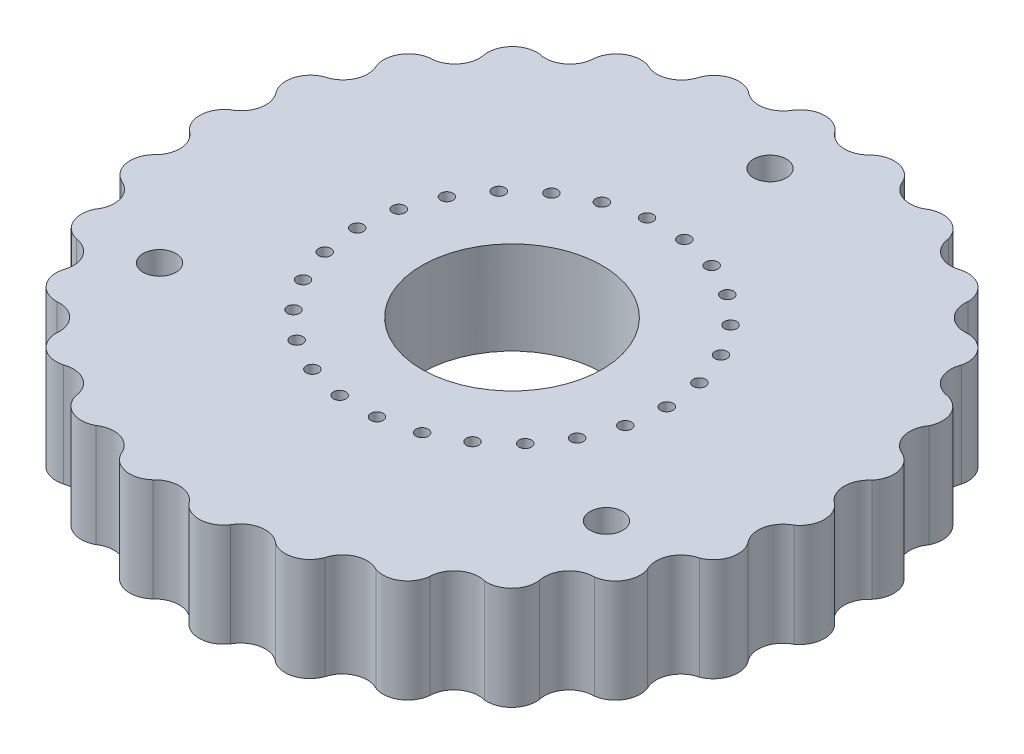
from build123d import *

# Parameters (mm, degrees)
EXTRUDE_WHEEL_DEPTH        = 10
CIRPATTERN1_COUNT          = 26
SKETCH4_R                  = 29
BOSS_EXTRUDE1_DEPTH        = 5
BEARING_HOLE_R             = 8.73125
CUT_BEARING_HOLE_DEPTH     = 48.798947189
PCB_INSET_CUT_DEPTH        = 1
PCB_START                  = -1
PCB_INSET_CUT_2_DEPTH      = 1
PCB_OUTPUT_HOLES_R         = 0.6
PCB_OUTPUT_HOLES_CUT_DEPTH = 48.494624458
SKETCH5_R                  = 1.5875
ALIGNMENT_PIN_CUTOUT_DEPTH = 48.494624458
SKETCH6_R                  = 48.487293603
CUT_EXTRUDE1_DEPTH         = 47.472995948


with BuildPart() as part:
    # Wheel → Extrude wheel (new body)
    with BuildSketch(Plane(origin=(0, 0, 0), x_dir=(1, 0, 0), z_dir=(0, 1, 0))):
        with BuildLine():
            Line((0, 0), (29.128254523, 7.179469929))
            Line((29.128254523, 7.179469929), (30.341931795, 7.478614509))
            ThreePointArc((30.341931795, 7.478614509), (31.616410176, 5.808198613), (31.087663821, 3.774725795))
            ThreePointArc((31.087663821, 3.774725795), (30.249976155, 1.847846509), (31.25, 0))
            Line((31.25, 0), (30, 0))
            Line((30, 0), (0, 0))
        make_face()
    extrude_wheel = extrude(amount=EXTRUDE_WHEEL_DEPTH)

    # CirPattern1: Extrude wheel ×26 about axis
    cirpattern1_axis = Axis((0, 10, 0), (0, -1, 0))
    for i in range(1, CIRPATTERN1_COUNT):
        add(extrude_wheel.rotate(cirpattern1_axis, i * 360 / CIRPATTERN1_COUNT))

    # Sketch4 → Boss-Extrude1 (add)
    with BuildSketch(Plane(origin=(0, 10, 0), x_dir=(1, 0, 0), z_dir=(0, 1, 0))):
        Circle(SKETCH4_R)
    extrude(amount=BOSS_EXTRUDE1_DEPTH)

    # Bearing hole → Cut bearing hole (cut, through all)
    with BuildSketch(Plane(origin=(0, 15, 0), x_dir=(1, 0, 0), z_dir=(0, 1, 0))):
        Circle(BEARING_HOLE_R)
    extrude(amount=-CUT_BEARING_HOLE_DEPTH, mode=Mode.SUBTRACT)

    # PCB inset → PCB inset cut (cut)
    with BuildSketch(Plane(origin=(0, 15, 0), x_dir=(1, 0, 0), z_dir=(0, 1, 0))):
        with BuildLine():
            Line((-1, 27.481812167), (-1, 29.481812167))
            Line((-1, 29.481812167), (1, 29.481812167))
            Line((1, 29.481812167), (1, 27.481812167))
            ThreePointArc((1, 27.481812167), (0, -27.5), (-1, 27.481812167))
        make_face()
    extrude(amount=-PCB_INSET_CUT_DEPTH, mode=Mode.SUBTRACT)

    # PCB inset 2 → PCB inset cut 2 (cut)
    with BuildSketch(Plane.XZ.offset(PCB_START)):
        with BuildLine():
            Line((1, -27.481812167), (1, -29.481812167))
            Line((1, -29.481812167), (-1, -29.481812167))
            Line((-1, -29.481812167), (-1, -27.481812167))
            ThreePointArc((-1, -27.481812167), (0, 27.5), (1, -27.481812167))
        make_face()
    extrude(amount=PCB_INSET_CUT_2_DEPTH, mode=Mode.SUBTRACT)

    # PCB output holes → PCB output holes cut (cut, through all)
    with BuildSketch(Plane(origin=(0, 14, 0), x_dir=(1, 0, 0), z_dir=(0, 1, 0))):
        with Locations((15, 0)):
            Circle(PCB_OUTPUT_HOLES_R)
        with Locations((14.564127261, -3.589734964)):
            Circle(PCB_OUTPUT_HOLES_R)
        with Locations((13.281840385, -6.970847581)):
            Circle(PCB_OUTPUT_HOLES_R)
        with Locations((11.227661223, -9.946839874)):
            Circle(PCB_OUTPUT_HOLES_R)
        with Locations((8.520971201, -12.344757988)):
            Circle(PCB_OUTPUT_HOLES_R)
        with Locations((5.319073306, -14.02524364)):
            Circle(PCB_OUTPUT_HOLES_R)
        with Locations((1.808050204, -14.890633111)):
            Circle(PCB_OUTPUT_HOLES_R)
        with Locations((-1.808050204, -14.890633111)):
            Circle(PCB_OUTPUT_HOLES_R)
        with Locations((-5.319073306, -14.02524364)):
            Circle(PCB_OUTPUT_HOLES_R)
        with Locations((-8.520971201, -12.344757988)):
            Circle(PCB_OUTPUT_HOLES_R)
        with Locations((-11.227661223, -9.946839874)):
            Circle(PCB_OUTPUT_HOLES_R)
        with Locations((-13.281840385, -6.970847581)):
            Circle(PCB_OUTPUT_HOLES_R)
        with Locations((-14.564127261, -3.589734964)):
            Circle(PCB_OUTPUT_HOLES_R)
        with Locations((-15, 0)):
            Circle(PCB_OUTPUT_HOLES_R)
        with Locations((-14.564127261, 3.589734964)):
            Circle(PCB_OUTPUT_HOLES_R)
        with Locations((-13.281840385, 6.970847581)):
            Circle(PCB_OUTPUT_HOLES_R)
        with Locations((-11.227661223, 9.946839874)):
            Circle(PCB_OUTPUT_HOLES_R)
        with Locations((-8.520971201, 12.344757988)):
            Circle(PCB_OUTPUT_HOLES_R)
        with Locations((-5.319073306, 14.02524364)):
            Circle(PCB_OUTPUT_HOLES_R)
        with Locations((-1.808050204, 14.890633111)):
            Circle(PCB_OUTPUT_HOLES_R)
        with Locations((1.808050204, 14.890633111)):
            Circle(PCB_OUTPUT_HOLES_R)
        with Locations((5.319073306, 14.02524364)):
            Circle(PCB_OUTPUT_HOLES_R)
        with Locations((8.520971201, 12.344757988)):
            Circle(PCB_OUTPUT_HOLES_R)
        with Locations((11.227661223, 9.946839874)):
            Circle(PCB_OUTPUT_HOLES_R)
        with Locations((13.281840385, 6.970847581)):
            Circle(PCB_OUTPUT_HOLES_R)
        with Locations((14.564127261, 3.589734964)):
            Circle(PCB_OUTPUT_HOLES_R)
    extrude(amount=-PCB_OUTPUT_HOLES_CUT_DEPTH, mode=Mode.SUBTRACT)

    # Sketch5 → Alignment pin cutout (cut, through all)
    with BuildSketch(Plane.XZ.offset(-1)):
        with Locations((0, -25)):
            Circle(SKETCH5_R)
        with Locations((-21.650635095, 12.5)):
            Circle(SKETCH5_R)
        with Locations((21.650635095, 12.5)):
            Circle(SKETCH5_R)
    extrude(amount=-ALIGNMENT_PIN_CUTOUT_DEPTH, mode=Mode.SUBTRACT)

    # Sketch6 → Cut-Extrude1 (cut, through all)
    with BuildSketch(Plane(origin=(0, 10, 0), x_dir=(1, 0, 0), z_dir=(0, 1, 0))):
        Circle(SKETCH6_R)
    extrude(amount=CUT_EXTRUDE1_DEPTH, mode=Mode.SUBTRACT)


solid = part.part
